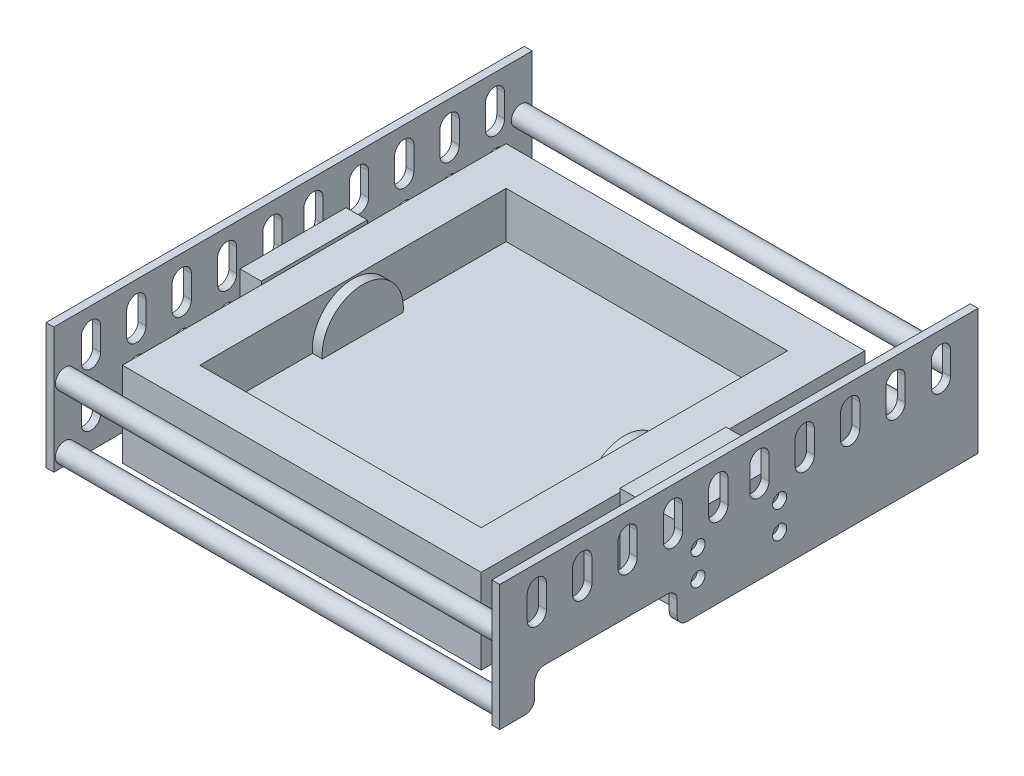
from build123d import *

# Parameters (mm, degrees)
SKETCH1_R               = 2.5019
BOSS_EXTRUDE1_DEPTH     = 115.316
BOSS_EXTRUDE1_2_DEPTH   = 115.316
BOSS_EXTRUDE1_3_DEPTH   = 115.316
BOSS_EXTRUDE1_4_DEPTH   = 115.316
SKETCH5_W               = 123.698
SKETCH5_H               = 32.512
SKETCH5_R               = 1.82245
BOSS_EXTRUDE3_DEPTH     = 2.032
SKETCH6_R               = 1.82245
BOSS_EXTRUDE4_DEPTH     = 2.032
SKETCH7_W               = 27.4193
SKETCH7_H               = 19.7612
BOSS_EXTRUDE5_DEPTH     = 15
SKETCH8_W               = 27.4193
SKETCH8_H               = 19.7612
BOSS_EXTRUDE6_DEPTH     = 5.5
SKETCH9_W               = 92.784
SKETCH9_H               = 99.2378
BOSS_EXTRUDE7_DEPTH     = 21.9329
CUT_EXTRUDE1_DEPTH      = 2.54
CUT_EXTRUDE1_DEPTH_BACK = 2.54
SKETCH10_R              = 0.508
CUT_EXTRUDE2_DEPTH      = 2.54
CUT_EXTRUDE2_DEPTH_BACK = 2.54
SKETCH11_R              = 0.508
SHELL1_START            = 20.072
SHELL1_OUTLINE_W        = 11.9329
SHELL1_OUTLINE_H        = 79.2378
SHELL1_DEPTH            = 67.704
SHELL1_START_2          = 17.532
SHELL1_2_DEPTH          = 72.784


# Read off the part's stored shape, not the designer's step: Shell1
with BuildPart() as part:
    # Sketch1 → Boss-Extrude1 (new body)
    with BuildSketch(Plane(origin=(0, 0, 0), x_dir=(0, 0, -1), z_dir=(1, 0, 0))):
        with Locations(Location((0, 0, 0), (0, 0, 180))):
            Circle(SKETCH1_R)
    extrude(amount=BOSS_EXTRUDE1_DEPTH)



with BuildPart() as body_2:
    # Sketch1 → Boss-Extrude1 2 (new body)
    with BuildSketch(Plane(origin=(0, 0, 0), x_dir=(0, 0, -1), z_dir=(1, 0, 0))):
        with Locations(Location((0, -16.4338, 0), (0, 0, 180))):
            Circle(SKETCH1_R)
    extrude(amount=BOSS_EXTRUDE1_2_DEPTH)


with BuildPart() as body_3:
    # Sketch1 → Boss-Extrude1 3 (new body)
    with BuildSketch(Plane(origin=(0, 0, 0), x_dir=(0, 0, -1), z_dir=(1, 0, 0))):
        with Locations(Location((117.9322, -16.4338, 0), (0, 0, 180))):
            Circle(SKETCH1_R)
    extrude(amount=BOSS_EXTRUDE1_3_DEPTH)


with BuildPart() as body_4:
    # Sketch1 → Boss-Extrude1 4 (new body)
    with BuildSketch(Plane(origin=(0, 0, 0), x_dir=(0, 0, -1), z_dir=(1, 0, 0))):
        with Locations(Location((117.9322, 0, 0), (0, 0, 180))):
            Circle(SKETCH1_R)
    extrude(amount=BOSS_EXTRUDE1_4_DEPTH)


with BuildPart() as part_1:
    add(part.part)

    add(body_2.part)  # Boss-Extrude3 merges body 2

    add(body_3.part)  # Boss-Extrude3 merges body 3

    add(body_4.part)  # Boss-Extrude3 merges body 4
    # Sketch5 → Boss-Extrude3 (add)
    with BuildSketch(Plane(origin=(0, 0, 0), x_dir=(0, 0, -1), z_dir=(1, 0, 0))):
        with Locations((58.9661, -3.302)):
            Rectangle(SKETCH5_W, SKETCH5_H)
        with Locations((48.43145, -4.43865)):
            Circle(SKETCH5_R, mode=Mode.SUBTRACT)
        with Locations((48.43145, -11.49985)):
            Circle(SKETCH5_R, mode=Mode.SUBTRACT)
        with Locations((69.50075, -4.43865)):
            Circle(SKETCH5_R, mode=Mode.SUBTRACT)
        with Locations((69.50075, -11.49985)):
            Circle(SKETCH5_R, mode=Mode.SUBTRACT)
        with BuildLine():
            Line((66.7639, 1.27), (66.7639, 7.2136))
            ThreePointArc((66.7639, 7.2136), (64.2747, 9.7028), (61.7855, 7.2136))
            Line((61.7855, 7.2136), (61.7855, 1.27))
            ThreePointArc((61.7855, 1.27), (64.2747, -1.2192), (66.7639, 1.27))
        make_face(mode=Mode.SUBTRACT)
        with BuildLine():
            Line((66.7639, -12.5095), (66.7639, -6.5659))
            ThreePointArc((66.7639, -6.5659), (64.2747, -4.0767), (61.7855, -6.5659))
            Line((61.7855, -6.5659), (61.7855, -12.5095))
            ThreePointArc((61.7855, -12.5095), (64.2747, -14.9987), (66.7639, -12.5095))
        make_face(mode=Mode.SUBTRACT)
        with BuildLine():
            Line((78.4987, -12.5095), (78.4987, -6.5659))
            ThreePointArc((78.4987, -6.5659), (76.0095, -4.0767), (73.5203, -6.5659))
            Line((73.5203, -6.5659), (73.5203, -12.5095))
            ThreePointArc((73.5203, -12.5095), (76.0095, -14.9987), (78.4987, -12.5095))
        make_face(mode=Mode.SUBTRACT)
        with BuildLine():
            Line((4.2291, 1.27), (4.2291, 7.2136))
            ThreePointArc((4.2291, 7.2136), (6.7183, 9.7028), (9.2075, 7.2136))
            Line((9.2075, 7.2136), (9.2075, 1.27))
            ThreePointArc((9.2075, 1.27), (6.7183, -1.2192), (4.2291, 1.27))
        make_face(mode=Mode.SUBTRACT)
        with BuildLine():
            Line((15.9639, 1.27), (15.9639, 7.2136))
            ThreePointArc((15.9639, 7.2136), (18.4531, 9.7028), (20.9423, 7.2136))
            Line((20.9423, 7.2136), (20.9423, 1.27))
            ThreePointArc((20.9423, 1.27), (18.4531, -1.2192), (15.9639, 1.27))
        make_face(mode=Mode.SUBTRACT)
        with BuildLine():
            Line((27.6987, 1.27), (27.6987, 7.2136))
            ThreePointArc((27.6987, 7.2136), (30.1879, 9.7028), (32.6771, 7.2136))
            Line((32.6771, 7.2136), (32.6771, 1.27))
            ThreePointArc((32.6771, 1.27), (30.1879, -1.2192), (27.6987, 1.27))
        make_face(mode=Mode.SUBTRACT)
        with BuildLine():
            Line((39.4335, 1.27), (39.4335, 7.2136))
            ThreePointArc((39.4335, 7.2136), (41.9227, 9.7028), (44.4119, 7.2136))
            Line((44.4119, 7.2136), (44.4119, 1.27))
            ThreePointArc((44.4119, 1.27), (41.9227, -1.2192), (39.4335, 1.27))
        make_face(mode=Mode.SUBTRACT)
        with BuildLine():
            Line((51.1683, 1.27), (51.1683, 7.2136))
            ThreePointArc((51.1683, 7.2136), (53.6575, 9.7028), (56.1467, 7.2136))
            Line((56.1467, 7.2136), (56.1467, 1.27))
            ThreePointArc((56.1467, 1.27), (53.6575, -1.2192), (51.1683, 1.27))
        make_face(mode=Mode.SUBTRACT)
        with BuildLine():
            Line((15.9639, -12.5095), (15.9639, -6.5659))
            ThreePointArc((15.9639, -6.5659), (18.4531, -4.0767), (20.9423, -6.5659))
            Line((20.9423, -6.5659), (20.9423, -12.5095))
            ThreePointArc((20.9423, -12.5095), (18.4531, -14.9987), (15.9639, -12.5095))
        make_face(mode=Mode.SUBTRACT)
        with BuildLine():
            Line((27.6987, -12.5095), (27.6987, -6.5659))
            ThreePointArc((27.6987, -6.5659), (30.1879, -4.0767), (32.6771, -6.5659))
            Line((32.6771, -6.5659), (32.6771, -12.5095))
            ThreePointArc((32.6771, -12.5095), (30.1879, -14.9987), (27.6987, -12.5095))
        make_face(mode=Mode.SUBTRACT)
        with BuildLine():
            Line((39.4335, -12.5095), (39.4335, -6.5659))
            ThreePointArc((39.4335, -6.5659), (41.9227, -4.0767), (44.4119, -6.5659))
            Line((44.4119, -6.5659), (44.4119, -12.5095))
            ThreePointArc((44.4119, -12.5095), (41.9227, -14.9987), (39.4335, -12.5095))
        make_face(mode=Mode.SUBTRACT)
        with BuildLine():
            Line((51.1683, -12.5095), (51.1683, -6.5659))
            ThreePointArc((51.1683, -6.5659), (53.6575, -4.0767), (56.1467, -6.5659))
            Line((56.1467, -6.5659), (56.1467, -12.5095))
            ThreePointArc((56.1467, -12.5095), (53.6575, -14.9987), (51.1683, -12.5095))
        make_face(mode=Mode.SUBTRACT)
        with BuildLine():
            Line((4.2291, -12.5095), (4.2291, -6.5659))
            ThreePointArc((4.2291, -6.5659), (6.7183, -4.0767), (9.2075, -6.5659))
            Line((9.2075, -6.5659), (9.2075, -12.5095))
            ThreePointArc((9.2075, -12.5095), (6.7183, -14.9987), (4.2291, -12.5095))
        make_face(mode=Mode.SUBTRACT)
        with BuildLine():
            Line((78.4987, 1.27), (78.4987, 7.2136))
            ThreePointArc((78.4987, 7.2136), (76.0095, 9.7028), (73.5203, 7.2136))
            Line((73.5203, 7.2136), (73.5203, 1.27))
            ThreePointArc((73.5203, 1.27), (76.0095, -1.2192), (78.4987, 1.27))
        make_face(mode=Mode.SUBTRACT)
        with BuildLine():
            Line((90.2335, 1.27), (90.2335, 7.2136))
            ThreePointArc((90.2335, 7.2136), (87.7443, 9.7028), (85.2551, 7.2136))
            Line((85.2551, 7.2136), (85.2551, 1.27))
            ThreePointArc((85.2551, 1.27), (87.7443, -1.2192), (90.2335, 1.27))
        make_face(mode=Mode.SUBTRACT)
        with BuildLine():
            Line((90.2335, -12.5095), (90.2335, -6.5659))
            ThreePointArc((90.2335, -6.5659), (87.7443, -4.0767), (85.2551, -6.5659))
            Line((85.2551, -6.5659), (85.2551, -12.5095))
            ThreePointArc((85.2551, -12.5095), (87.7443, -14.9987), (90.2335, -12.5095))
        make_face(mode=Mode.SUBTRACT)
        with BuildLine():
            Line((101.9683, -12.5095), (101.9683, -6.5659))
            ThreePointArc((101.9683, -6.5659), (99.4791, -4.0767), (96.9899, -6.5659))
            Line((96.9899, -6.5659), (96.9899, -12.5095))
            ThreePointArc((96.9899, -12.5095), (99.4791, -14.9987), (101.9683, -12.5095))
        make_face(mode=Mode.SUBTRACT)
        with BuildLine():
            Line((101.9683, 1.27), (101.9683, 7.2136))
            ThreePointArc((101.9683, 7.2136), (99.4791, 9.7028), (96.9899, 7.2136))
            Line((96.9899, 7.2136), (96.9899, 1.27))
            ThreePointArc((96.9899, 1.27), (99.4791, -1.2192), (101.9683, 1.27))
        make_face(mode=Mode.SUBTRACT)
        with BuildLine():
            Line((113.7031, 1.27), (113.7031, 7.2136))
            ThreePointArc((113.7031, 7.2136), (111.2139, 9.7028), (108.7247, 7.2136))
            Line((108.7247, 7.2136), (108.7247, 1.27))
            ThreePointArc((108.7247, 1.27), (111.2139, -1.2192), (113.7031, 1.27))
        make_face(mode=Mode.SUBTRACT)
        with BuildLine():
            Line((113.7031, -12.5095), (113.7031, -6.5659))
            ThreePointArc((113.7031, -6.5659), (111.2139, -4.0767), (108.7247, -6.5659))
            Line((108.7247, -6.5659), (108.7247, -12.5095))
            ThreePointArc((108.7247, -12.5095), (111.2139, -14.9987), (113.7031, -12.5095))
        make_face(mode=Mode.SUBTRACT)
    extrude(amount=BOSS_EXTRUDE3_DEPTH)



with BuildPart() as body_2_2:
    # Sketch6 → Boss-Extrude4 (new body)
    with BuildSketch(Plane(origin=(115.316, 0, 0), x_dir=(0, 0, -1), z_dir=(1, 0, 0))):
        with BuildLine():
            Line((-2.8829, -19.558), (3.6195, -19.558))
            ThreePointArc((3.6195, -19.558), (5.415551224, -18.814051224), (6.1595, -17.018))
            Line((6.1595, -17.018), (6.1595, -13.4112))
            ThreePointArc((6.1595, -13.4112), (6.903448776, -11.615148776), (8.6995, -10.8712))
            Line((8.6995, -10.8712), (40.4495, -10.8712))
            ThreePointArc((40.4495, -10.8712), (42.245551224, -11.615148776), (42.9895, -13.4112))
            Line((42.9895, -13.4112), (42.9895, -17.018))
            ThreePointArc((42.9895, -17.018), (43.733448776, -18.814051224), (45.5295, -19.558))
            Line((45.5295, -19.558), (120.8151, -19.558))
            Line((120.8151, -19.558), (120.8151, 12.954))
            Line((120.8151, 12.954), (-2.8829, 12.954))
            Line((-2.8829, 12.954), (-2.8829, -19.558))
        make_face()
        with Locations((48.43145, -4.43865)):
            Circle(SKETCH6_R, mode=Mode.SUBTRACT)
        with Locations((69.50075, -4.43865)):
            Circle(SKETCH6_R, mode=Mode.SUBTRACT)
        with Locations((69.50075, -11.49985)):
            Circle(SKETCH6_R, mode=Mode.SUBTRACT)
        with Locations((48.43145, -11.49985)):
            Circle(SKETCH6_R, mode=Mode.SUBTRACT)
        with BuildLine():
            Line((15.9639, 7.2136), (15.9639, 1.27))
            ThreePointArc((15.9639, 1.27), (18.4531, -1.2192), (20.9423, 1.27))
            Line((20.9423, 1.27), (20.9423, 7.2136))
            ThreePointArc((20.9423, 7.2136), (18.4531, 9.7028), (15.9639, 7.2136))
        make_face(mode=Mode.SUBTRACT)
        with BuildLine():
            Line((9.2075, 1.27), (9.2075, 7.2136))
            ThreePointArc((9.2075, 7.2136), (6.7183, 9.7028), (4.2291, 7.2136))
            Line((4.2291, 7.2136), (4.2291, 1.27))
            ThreePointArc((4.2291, 1.27), (6.7183, -1.2192), (9.2075, 1.27))
        make_face(mode=Mode.SUBTRACT)
        with BuildLine():
            Line((27.6987, 7.2136), (27.6987, 1.27))
            ThreePointArc((27.6987, 1.27), (30.1879, -1.2192), (32.6771, 1.27))
            Line((32.6771, 1.27), (32.6771, 7.2136))
            ThreePointArc((32.6771, 7.2136), (30.1879, 9.7028), (27.6987, 7.2136))
        make_face(mode=Mode.SUBTRACT)
        with BuildLine():
            Line((39.4335, 7.2136), (39.4335, 1.27))
            ThreePointArc((39.4335, 1.27), (41.9227, -1.2192), (44.4119, 1.27))
            Line((44.4119, 1.27), (44.4119, 7.2136))
            ThreePointArc((44.4119, 7.2136), (41.9227, 9.7028), (39.4335, 7.2136))
        make_face(mode=Mode.SUBTRACT)
        with BuildLine():
            Line((51.1683, 7.2136), (51.1683, 1.27))
            ThreePointArc((51.1683, 1.27), (53.6575, -1.2192), (56.1467, 1.27))
            Line((56.1467, 1.27), (56.1467, 7.2136))
            ThreePointArc((56.1467, 7.2136), (53.6575, 9.7028), (51.1683, 7.2136))
        make_face(mode=Mode.SUBTRACT)
        with BuildLine():
            Line((61.7855, 1.27), (61.7855, 7.2136))
            ThreePointArc((61.7855, 7.2136), (64.2747, 9.7028), (66.7639, 7.2136))
            Line((66.7639, 7.2136), (66.7639, 1.27))
            ThreePointArc((66.7639, 1.27), (64.2747, -1.2192), (61.7855, 1.27))
        make_face(mode=Mode.SUBTRACT)
        with BuildLine():
            Line((73.5203, 1.27), (73.5203, 7.2136))
            ThreePointArc((73.5203, 7.2136), (76.0095, 9.7028), (78.4987, 7.2136))
            Line((78.4987, 7.2136), (78.4987, 1.27))
            ThreePointArc((78.4987, 1.27), (76.0095, -1.2192), (73.5203, 1.27))
        make_face(mode=Mode.SUBTRACT)
        with BuildLine():
            Line((85.2551, 1.27), (85.2551, 7.2136))
            ThreePointArc((85.2551, 7.2136), (87.7443, 9.7028), (90.2335, 7.2136))
            Line((90.2335, 7.2136), (90.2335, 1.27))
            ThreePointArc((90.2335, 1.27), (87.7443, -1.2192), (85.2551, 1.27))
        make_face(mode=Mode.SUBTRACT)
        with BuildLine():
            Line((96.9899, 1.27), (96.9899, 7.2136))
            ThreePointArc((96.9899, 7.2136), (99.4791, 9.7028), (101.9683, 7.2136))
            Line((101.9683, 7.2136), (101.9683, 1.27))
            ThreePointArc((101.9683, 1.27), (99.4791, -1.2192), (96.9899, 1.27))
        make_face(mode=Mode.SUBTRACT)
        with BuildLine():
            Line((113.7031, 7.2136), (113.7031, 1.27))
            ThreePointArc((113.7031, 1.27), (111.2139, -1.2192), (108.7247, 1.27))
            Line((108.7247, 1.27), (108.7247, 7.2136))
            ThreePointArc((108.7247, 7.2136), (111.2139, 9.7028), (113.7031, 7.2136))
        make_face(mode=Mode.SUBTRACT)
    extrude(amount=BOSS_EXTRUDE4_DEPTH)


with BuildPart() as part_2:
    add(part_1.part)

    add(body_2_2.part)  # Boss-Extrude5 merges body 2 2
    # Sketch7 → Boss-Extrude5 (add)
    with BuildSketch(Plane.ZY.offset(-115.316)):
        with Locations((-58.9661, -7.96925)):
            Rectangle(SKETCH7_W, SKETCH7_H)
    extrude(amount=BOSS_EXTRUDE5_DEPTH)

    # Sketch8 → Boss-Extrude6 (add)
    with BuildSketch(Plane(origin=(2.032, 0, 0), x_dir=(0, 0, -1), z_dir=(1, 0, 0))):
        with Locations((58.9661, -7.96925)):
            Rectangle(SKETCH8_W, SKETCH8_H)
    extrude(amount=BOSS_EXTRUDE6_DEPTH)


with BuildPart() as body_2_3:
    # Sketch9 → Boss-Extrude7 (new body)
    with BuildSketch(Plane(origin=(0, -20.8915, 0), x_dir=(-1, 0, 0), z_dir=(0, -1, 0))):
        with Locations((-53.924, 58.9661)):
            Rectangle(SKETCH9_W, SKETCH9_H)
    extrude(amount=-BOSS_EXTRUDE7_DEPTH)


with BuildPart() as cut_extrude1_tool:
    # Sketch10 → Cut-Extrude1 (new, two sides: drawn at the far end of the back side and taken through both)
    with BuildSketch(Plane.ZY.offset(-7.532).offset(-CUT_EXTRUDE1_DEPTH_BACK)):
        with Locations((-58.9661, -9.92505)):
            Circle(SKETCH10_R)
    extrude(amount=CUT_EXTRUDE1_DEPTH + CUT_EXTRUDE1_DEPTH_BACK)


with BuildPart() as part_3:
    add(part_2.part)

    # Cut-Extrude1: cut by cut_extrude1_tool
    add(cut_extrude1_tool.part, mode=Mode.SUBTRACT)


with BuildPart() as body_2_3_1:
    add(body_2_3.part)

    # Cut-Extrude1: cut by cut_extrude1_tool
    add(cut_extrude1_tool.part, mode=Mode.SUBTRACT)


with BuildPart() as cut_extrude2_tool:
    # Sketch11 → Cut-Extrude2 (new, two sides: drawn at the far end of the back side and taken through both)
    with BuildSketch(Plane(origin=(100.316, 0, 0), x_dir=(0, 0, -1), z_dir=(1, 0, 0)).offset(-CUT_EXTRUDE2_DEPTH_BACK)):
        with Locations(Location((58.9661, -9.92505, 0), (0, 0, 180))):
            Circle(SKETCH11_R)
    extrude(amount=CUT_EXTRUDE2_DEPTH + CUT_EXTRUDE2_DEPTH_BACK)


with BuildPart() as part_4:
    add(part_3.part)

    # Cut-Extrude2: cut by cut_extrude2_tool
    add(cut_extrude2_tool.part, mode=Mode.SUBTRACT)


with BuildPart() as body_2_3_2:
    add(body_2_3_1.part)

    # Cut-Extrude2: cut by cut_extrude2_tool
    add(cut_extrude2_tool.part, mode=Mode.SUBTRACT)

    # Shell1 outline → Shell1 (cut)
    with BuildSketch(Plane.YZ.offset(SHELL1_START)):
        with Locations((-4.92505, -58.9661)):
            Rectangle(SHELL1_OUTLINE_W, SHELL1_OUTLINE_H)
    extrude(amount=SHELL1_DEPTH, mode=Mode.SUBTRACT)

    # Shell1 2 outline → Shell1 2 (cut)
    with BuildSketch(Plane.YZ.offset(SHELL1_START_2)):
        with BuildLine():
            Line((1.0414, -19.3472), (-10.8915, -19.3472))
            Line((-10.8915, -19.3472), (-10.8915, -48.502637934))
            ThreePointArc((-10.8915, -48.502637934), (0.58295, -58.9661), (-10.8915, -69.429562066))
            Line((-10.8915, -69.429562066), (-10.8915, -98.585))
            Line((-10.8915, -98.585), (1.0414, -98.585))
            Line((1.0414, -98.585), (1.0414, -19.3472))
        make_face()
    extrude(amount=SHELL1_2_DEPTH, mode=Mode.SUBTRACT)


solid = Compound([part_4.part, body_2_3_2.part])
